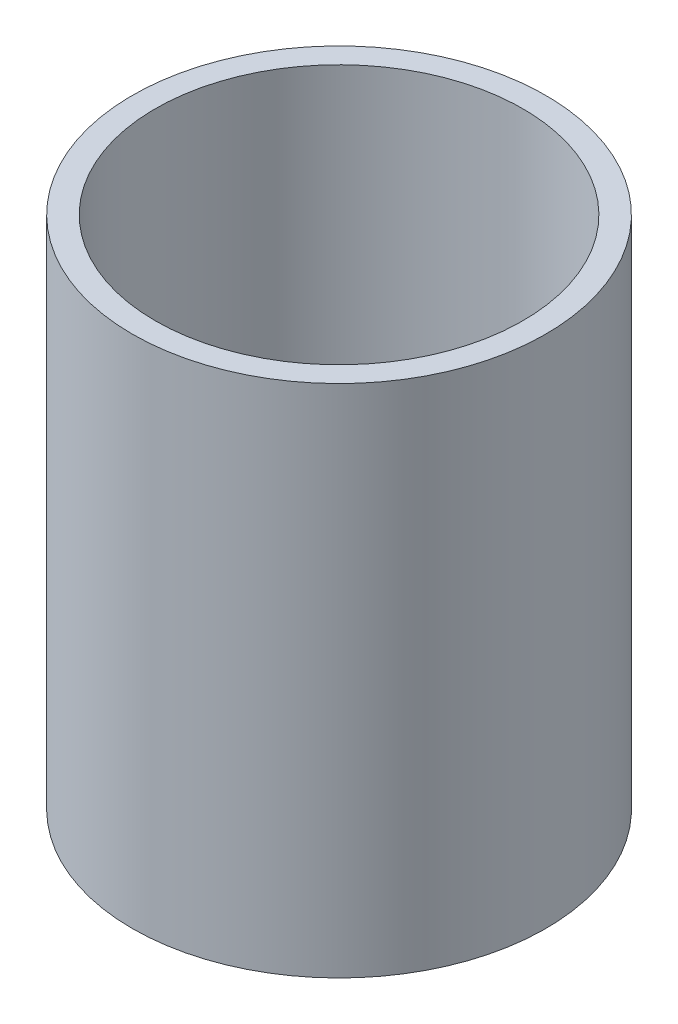
from build123d import *

# Parameters (mm, degrees)
SKETCH1_R           = 32.5
BOSS_EXTRUDE1_DEPTH = 80.92067051
SKETCH2_R           = 28.88386291
CUT_EXTRUDE1_DEPTH  = 94.062639743


with BuildPart() as part:
    # Sketch1 → Boss-Extrude1 (new body)
    with BuildSketch(Plane(origin=(0, 0, 0), x_dir=(1, 0, 0), z_dir=(0, 1, 0))):
        Circle(SKETCH1_R)
    extrude(amount=BOSS_EXTRUDE1_DEPTH)

    # Sketch2 → Cut-Extrude1 (cut, through all)
    with BuildSketch(Plane(origin=(0, 0, 0), x_dir=(1, 0, 0), z_dir=(0, 1, 0))):
        Circle(SKETCH2_R)
    extrude(amount=CUT_EXTRUDE1_DEPTH, mode=Mode.SUBTRACT)


solid = part.part
